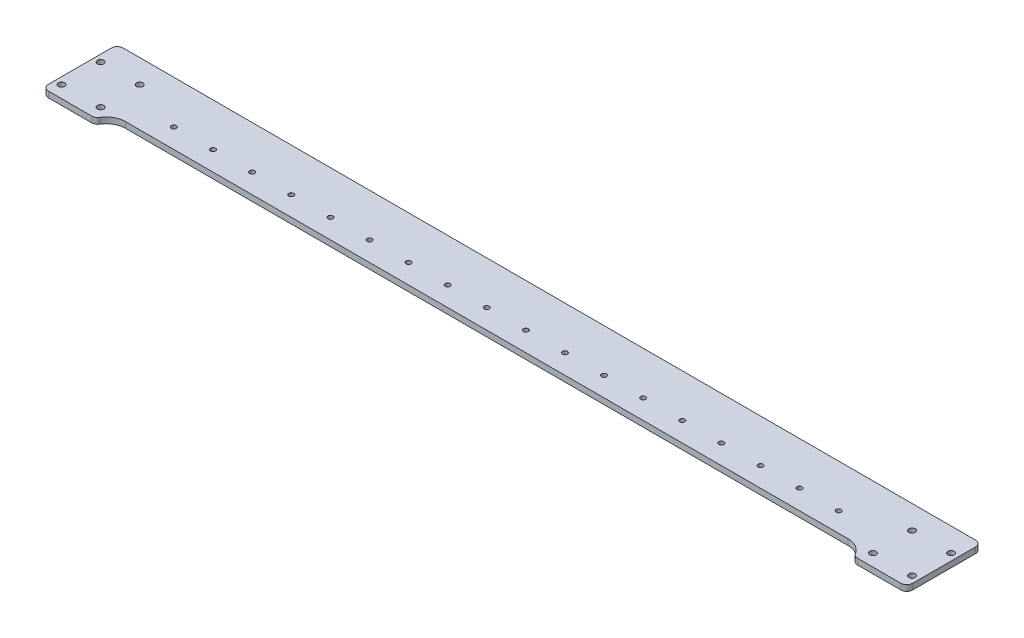
from build123d import *

# Parameters (mm, degrees)
BOSS_EXTRUDE1_DEPTH                   = 3
M3_CLEARANCE_HOLE1_D                  = 3.2
M3_CLEARANCE_HOLE1_CSINK_D            = 3.25
M3_CLEARANCE_HOLE1_CSINK_ANGLE        = 90
FILLET1_R                             = 10
FILLET2_R                             = 3
TAP_DRILL_FOR_M3X0_5_TAP1_D           = 2.5
TAP_DRILL_FOR_M3X0_5_TAP1_CSINK_D     = 2.55
TAP_DRILL_FOR_M3X0_5_TAP1_CSINK_ANGLE = 90


with BuildPart() as part:
    # Sketch1 → Boss-Extrude1 (new body)
    with BuildSketch(Plane(origin=(0, 0, 0), x_dir=(1, 0, 0), z_dir=(0, 1, 0))):
        Polygon((0, 0), (194, 0), (194, -6.2), (221, -6.2), (221, 26.2), (221, 32), (0, 32), (0, 26.2), align=None)
    extrude(amount=BOSS_EXTRUDE1_DEPTH)

    # M3 Clearance Hole1 (through all)
    with Locations(Plane(origin=(0, 3, 0), x_dir=(1, 0, 0), z_dir=(0, 1, 0))):
        with Locations((197.5, 20), (217.5, 0), (217.5, 20), (197.5, 0)):
            CounterSinkHole(M3_CLEARANCE_HOLE1_D / 2, M3_CLEARANCE_HOLE1_CSINK_D / 2, counter_sink_angle=M3_CLEARANCE_HOLE1_CSINK_ANGLE)

    # Fillet1
    # the kernel refuses this fillet: 10 mm, written as the material it adds along each edge
    with BuildSketch(Plane(origin=(194, 0, 0), x_dir=(-1, 0, 0), z_dir=(0, 1, 0))) as fillet1_piece_1:
        with BuildLine():
            CenterArc((9.249864864, 10), FILLET1_R, 202.333682658, 67.666317342)
            Line((0, 6.2), (-0.184997297, 6.124))
            ThreePointArc((-0.184997297, 6.124), (-0.2, 3.1), (-0.2, 0))
            Line((-0.2, 0), (0, -0.2))
            Line((0, -0.2), (9.249864864, -0.2))
            Line((9.249864864, -0.2), (9.249864864, 0))
        make_face()
    extrude(amount=3)

    # Fillet2
    fillet2_edges = [part.edges().sort_by_distance(p)[0] for p in [
        (221, 1.5, -32),
        (221, 1.5, 6.2),
        (194, 1.5, 6.2),
    ]]
    fillet(fillet2_edges, radius=FILLET2_R)

    # Mirror1: part across plane


with BuildPart() as part_1:
    add(part.part)
    add(part.part.mirror(Plane(origin=(0, 3, -32), x_dir=(0, 0, 1), z_dir=(1, 0, 0))))

    # Tap Drill for M3x0.5 Tap1 (through all)
    with Locations(Plane(origin=(0, 3, 0), x_dir=(1, 0, 0), z_dir=(0, 1, 0))):
        with Locations((-170, 10), (-150, 10), (-130, 10), (-110, 10), (-90, 10), (-70, 10), (-50, 10), (-30, 10), (-10, 10), (10, 10), (30, 10), (50, 10), (70, 10), (170, 10), (150, 10), (130, 10), (110, 10), (90, 10)):
            CounterSinkHole(TAP_DRILL_FOR_M3X0_5_TAP1_D / 2, TAP_DRILL_FOR_M3X0_5_TAP1_CSINK_D / 2, counter_sink_angle=TAP_DRILL_FOR_M3X0_5_TAP1_CSINK_ANGLE)


solid = part_1.part
